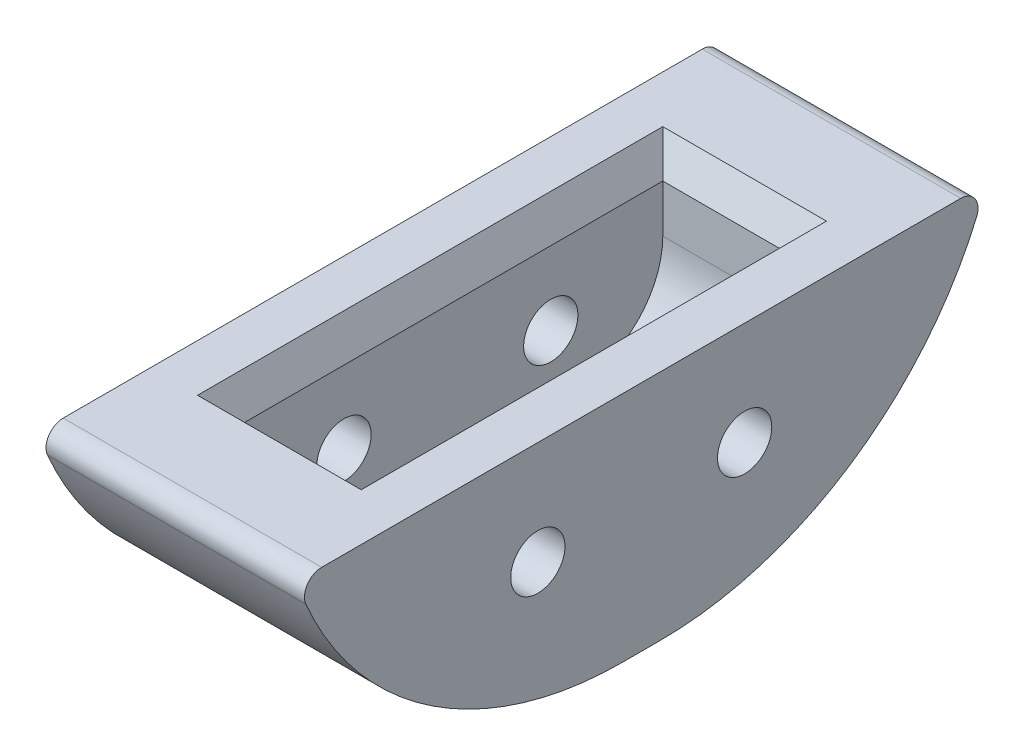
from build123d import *

# Parameters (mm, degrees)
SKETCH1_W           = 30
SKETCH1_H           = 80
BOSS_EXTRUDE1_DEPTH = 27
SKETCH5_W           = 30
SKETCH5_H           = 10
BOSS_EXTRUDE2_DEPTH = 6
SKETCH2_R           = 3.15
CUT_EXTRUDE1_DEPTH  = 40
FILLET5_R           = 40
FILLET6_R           = 40
FILLET7_R           = 2
FILLET8_R           = 2
SKETCH6_W           = 10
SKETCH6_H           = 6
CUT_EXTRUDE2_DEPTH  = 60.301649892
SKETCH7_W           = 15
SKETCH7_H           = 50
CUT_EXTRUDE3_DEPTH  = 19
FILLET9_R           = 10
CHAMFER1_SIZE       = 2
CHAMFER1_SIZE2      = 3.464101615


with BuildPart() as part:
    # Sketch1 → Boss-Extrude1 (new body)
    with BuildSketch(Plane(origin=(0, 0, 0), x_dir=(1, 0, 0), z_dir=(0, 1, 0))):
        Rectangle(SKETCH1_W, SKETCH1_H)
    extrude(amount=BOSS_EXTRUDE1_DEPTH)

    # Sketch5 → Boss-Extrude2 (add)
    with BuildSketch(Plane(origin=(0, 27, 0), x_dir=(1, 0, 0), z_dir=(0, 1, 0))):
        Rectangle(SKETCH5_W, SKETCH5_H)
    extrude(amount=BOSS_EXTRUDE2_DEPTH)

    # Sketch2 → Cut-Extrude1 (cut)
    with BuildSketch(Plane(origin=(15, 0, 0), x_dir=(0, 0, -1), z_dir=(1, 0, 0))):
        with Locations((-12, 15)):
            Circle(SKETCH2_R)
        with Locations(Location((12, 15, 0), (0, 0, 180))):
            Circle(SKETCH2_R)
    extrude(amount=-CUT_EXTRUDE1_DEPTH, mode=Mode.SUBTRACT)

    # Fillet5
    # the kernel refuses this fillet: 40 mm, written as the material it takes off along each edge
    with BuildSketch(Plane(origin=(109.571401597, 0, -40), x_dir=(0, 0, 1), z_dir=(-1, 0, 0))) as fillet5_piece_1:
        with BuildLine():
            CenterArc((37.828560639, 40), FILLET5_R, 198.965574989, 71.034425011)
            Line((0, 27), (-0.756571213, 26.74))
            ThreePointArc((-0.756571213, 26.74), (-0.8, 13.5), (-0.8, 0))
            Line((-0.8, 0), (0, -0.8))
            Line((0, -0.8), (37.828560639, -0.8))
            Line((37.828560639, -0.8), (37.828560639, 0))
        make_face()
    extrude(amount=219.142803194, mode=Mode.SUBTRACT)

    # Fillet6
    # the kernel refuses this fillet: 40 mm, written as the material it takes off along each edge
    with BuildSketch(Plane(origin=(-109.571401597, 0, 40), x_dir=(0, 1, 0), z_dir=(1, 0, 0))) as fillet6_piece_1:
        with BuildLine():
            CenterArc((40, -37.828560639), FILLET6_R, 108.965574989, 71.034425011)
            Line((0, -37.828560639), (-0.8, -37.828560639))
            Line((-0.8, -37.828560639), (-0.8, 0))
            Line((-0.8, 0), (0, 0.8))
            ThreePointArc((0, 0.8), (13.5, 0.8), (26.74, 0.756571213))
            Line((26.74, 0.756571213), (27, 0))
        make_face()
    extrude(amount=219.142803194, mode=Mode.SUBTRACT)

    # Fillet7
    fillet7_edges = [part.edges().sort_by_distance(p)[0] for p in [
        (0, 27, -40),
    ]]
    fillet(fillet7_edges, radius=FILLET7_R)

    # Fillet8
    fillet8_edges = [part.edges().sort_by_distance(p)[0] for p in [
        (0, 27, 40),
    ]]
    fillet(fillet8_edges, radius=FILLET8_R)

    # Sketch6 → Cut-Extrude2 (cut, through all)
    with BuildSketch(Plane(origin=(15, 0, 0), x_dir=(0, 0, -1), z_dir=(1, 0, 0))):
        with Locations((0, 30)):
            Rectangle(SKETCH6_W, SKETCH6_H)
    extrude(amount=-CUT_EXTRUDE2_DEPTH, mode=Mode.SUBTRACT)

    # Sketch7 → Cut-Extrude3 (cut)
    with BuildSketch(Plane(origin=(0, 27, 0), x_dir=(1, 0, 0), z_dir=(0, 1, 0))):
        Rectangle(SKETCH7_W, SKETCH7_H)
    extrude(amount=-CUT_EXTRUDE3_DEPTH, mode=Mode.SUBTRACT)

    # Fillet9
    fillet9_edges = [part.edges().sort_by_distance(p)[0] for p in [
        (0, 8, -25),
        (0, 8, 25),
    ]]
    fillet(fillet9_edges, radius=FILLET9_R)

    # Chamfer1
    chamfer1_edges = [part.edges().sort_by_distance(p)[0] for p in [
        (-7.5, 27, 0),
        (0, 27, 25),
        (7.5, 27, 0),
        (0, 27, -25),
    ]]
    chamfer1_side = [part.faces().sort_by_distance(p)[0] for p in [
        (-14.199914204, 27, 0),
    ]]
    chamfer(chamfer1_edges, length=CHAMFER1_SIZE, length2=CHAMFER1_SIZE2, reference=chamfer1_side[0])


solid = part.part
